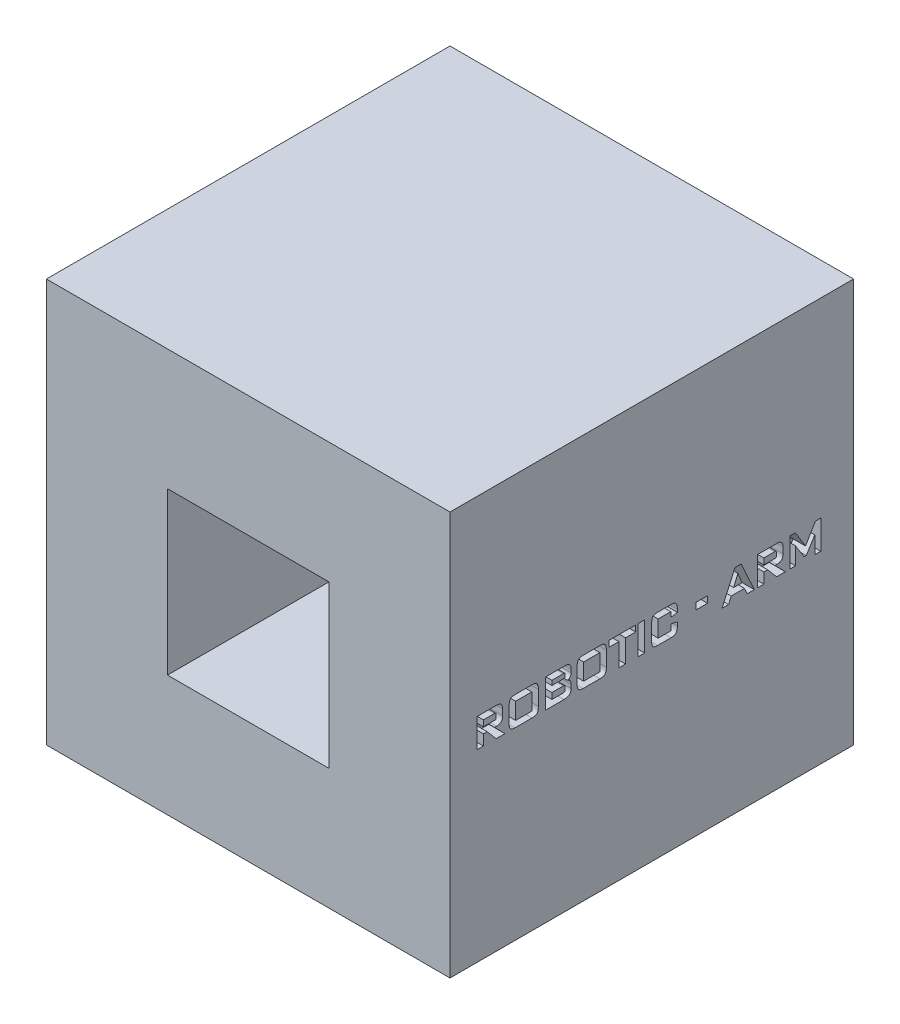
from build123d import *

# Parameters (mm, degrees)
ESQUISSE1_W                   = 50
ESQUISSE1_H                   = 50
ESQUISSE1_W_2                 = 20
ESQUISSE1_H_2                 = 20
BOSS_EXTRU_1_DEPTH            = 50
ESQUISSE5_W                   = 20
ESQUISSE5_H                   = 20
BOSS_EXTRU_5_DEPTH            = 1
ESQUISSE9_W                   = 20
ESQUISSE9_H                   = 20
BOSS_EXTRU_8_DEPTH            = 25
ESQUISSE10_W                  = 17
ESQUISSE10_H                  = 17
BOSS_EXTRU_9_DEPTH            = 10
ENL_V_START                   = -2
ENL_V_MAT_EXTRU_1_OUTLINE_W   = 2
ENL_V_MAT_EXTRU_1_OUTLINE_H   = 2.0625
ENL_V_MAT_EXTRU_1_OUTLINE_W_2 = 0.8125
ENL_V_MAT_EXTRU_1_OUTLINE_H_2 = 3.5625
ENL_V_MAT_EXTRU_1_OUTLINE_W_3 = 1.4375
ENL_V_MAT_EXTRU_1_OUTLINE_H_3 = 0.8125
ENL_V_MAT_EXTRU_1_DEPTH       = 2


# Read off the part's stored shape, not the designer's step: Enlèv. mat.-Extru.1
with BuildPart() as part:
    # Esquisse1 → Boss.-Extru.1 (new body)
    with BuildSketch(Plane.XY):
        with Locations((-14.262454104, 41.563864613)):
            Rectangle(ESQUISSE1_W, ESQUISSE1_H)
        with Locations((-14.262454104, 41.563864613)):
            Rectangle(ESQUISSE1_W_2, ESQUISSE1_H_2, mode=Mode.SUBTRACT)
    extrude(amount=BOSS_EXTRU_1_DEPTH)



with BuildPart() as body_2:
    # Esquisse5 → Boss.-Extru.5 (new body)
    with BuildSketch(Plane(origin=(0, 0, 0), x_dir=(-1, 0, 0), z_dir=(0, 0, -1))):
        with Locations((14.262454104, 41.563864613)):
            Rectangle(ESQUISSE5_W, ESQUISSE5_H)
    extrude(amount=BOSS_EXTRU_5_DEPTH)


with BuildPart() as part_1:
    add(part.part)

    add(body_2.part)  # Boss.-Extru.8 merges body 2
    # Esquisse9 → Boss.-Extru.8 (add)
    with BuildSketch(Plane.XY):
        with Locations((-14.262454104, 41.563864613)):
            Rectangle(ESQUISSE9_W, ESQUISSE9_H)
    extrude(amount=BOSS_EXTRU_8_DEPTH)

    # Esquisse10 → Boss.-Extru.9 (add)
    with BuildSketch(Plane(origin=(0, 0, -1), x_dir=(-1, 0, 0), z_dir=(0, 0, -1))):
        with Locations((14.262454104, 41.563864613)):
            Rectangle(ESQUISSE10_W, ESQUISSE10_H)
    extrude(amount=BOSS_EXTRU_9_DEPTH)

    # Enlèv. mat.-Extru.1 outline → Enlèv. mat.-Extru.1 (cut)
    # profile 1 of 11: a face of its own
    with BuildSketch(Plane(origin=(10.737545896, 0, 0), x_dir=(0, 0, -1), z_dir=(1, 0, 0)).offset(ENL_V_START)):
        with BuildLine():
            add(Edge.make_bspline(
                [(-9.494767923, 42.943838022), (-9.462202461, 42.943273829), (-9.399223316, 42.942182724), (-9.308307277, 42.933908591), (-9.224928323, 42.917691853), (-9.148019672, 42.897953209), (-9.078562995, 42.870581279), (-9.016316173, 42.837089542), (-8.961043247, 42.79819275), (-8.913653605, 42.75223849), (-8.872181622, 42.701149585), (-8.837393755, 42.643926122), (-8.806494551, 42.58213197), (-8.782522949, 42.514076077), (-8.762886777, 42.441003066), (-8.749318204, 42.362233228), (-8.741734313, 42.278298804), (-8.740512252, 42.22054609), (-8.73988511, 42.190908334)],
                knots=[0, 0, 0, 0, 0.07946826, 0.153685616, 0.222389009, 0.286552594, 0.347176836, 0.404041869, 0.458706221, 0.51151541, 0.56461057, 0.618834541, 0.67460726, 0.732902291, 0.794558509, 0.859070238, 0.927677135, 1, 1, 1, 1], degree=3))
            Line((-9.494767923, 42.943838022), (-11.92738511, 42.943838022))
            Line((-11.92738511, 42.943838022), (-11.92738511, 39.381338022))
            Line((-11.92738511, 39.381338022), (-11.11488511, 39.381338022))
            Line((-11.11488511, 39.381338022), (-11.11488511, 40.693838022))
            Line((-11.11488511, 40.693838022), (-10.654924173, 40.693838022))
            Line((-10.654924173, 40.693838022), (-9.53285386, 39.381338022))
            Line((-9.53285386, 39.381338022), (-8.448869485, 39.381338022))
            Line((-8.448869485, 39.381338022), (-9.734025735, 40.693838022))
            Line((-9.734025735, 40.693838022), (-9.494767923, 40.693838022))
            add(Edge.make_bspline(
                [(-8.73988511, 41.452627084), (-8.740505937, 41.422988371), (-8.741715691, 41.365233789), (-8.749415737, 41.280992876), (-8.762769552, 41.201864753), (-8.782486377, 41.12846068), (-8.806756701, 41.060233446), (-8.837077358, 40.997819151), (-8.872479261, 40.940321691), (-8.913635754, 40.888443763), (-8.96068988, 40.841348934), (-9.016632871, 40.802780817), (-9.078222727, 40.767727206), (-9.148252326, 40.741165315), (-9.224607655, 40.719236062), (-9.308532671, 40.70553928), (-9.399125128, 40.694999486), (-9.462180276, 40.694233759), (-9.494767923, 40.693838022)],
                knots=[0, 0, 0, 0, 0.072092161, 0.140480206, 0.205566229, 0.267025769, 0.325134843, 0.381441177, 0.435492177, 0.489036247, 0.542227895, 0.596717872, 0.653781811, 0.714212667, 0.778381974, 0.846724167, 0.920785238, 1, 1, 1, 1], degree=3))
            Line((-8.73988511, 41.452627084), (-8.73988511, 42.190908334))
        make_face()
        with BuildLine():
            add(Edge.make_bspline(
                [(-9.55238511, 42.009267709), (-9.552955056, 42.025892347), (-9.554001984, 42.056429962), (-9.561137036, 42.098309735), (-9.574707003, 42.131451737), (-9.594431296, 42.15783324), (-9.625480701, 42.175362931), (-9.667082813, 42.185427964), (-9.720689729, 42.193769253), (-9.760671699, 42.193813483), (-9.78285386, 42.193838022)],
                knots=[0, 0, 0, 0, 0.142165576, 0.261142378, 0.360895331, 0.446076577, 0.537230226, 0.658782582, 0.81069117, 1, 1, 1, 1], degree=3))
            Line((-9.55238511, 42.009267709), (-9.55238511, 41.631338022))
            add(Edge.make_bspline(
                [(-9.78285386, 41.443838022), (-9.760664504, 41.443852004), (-9.720346853, 41.443877409), (-9.666900862, 41.452388017), (-9.625061981, 41.461343604), (-9.594463442, 41.478916867), (-9.574443214, 41.505446871), (-9.561213484, 41.53943924), (-9.553932484, 41.582537981), (-9.552933062, 41.614057087), (-9.55238511, 41.631338022)],
                knots=[0, 0, 0, 0, 0.187399781, 0.340501955, 0.457438376, 0.547672803, 0.631995055, 0.733283697, 0.853767839, 1, 1, 1, 1], degree=3))
            Line((-9.78285386, 41.443838022), (-11.11488511, 41.443838022))
            Line((-11.11488511, 41.443838022), (-11.11488511, 42.193838022))
            Line((-11.11488511, 42.193838022), (-9.78285386, 42.193838022))
        make_face(mode=Mode.SUBTRACT)
    # profile 2 of 11: a face of its own
    with BuildSketch(Plane(origin=(10.737545896, 0, 0), x_dir=(0, 0, -1), z_dir=(1, 0, 0)).offset(ENL_V_START)):
        with BuildLine():
            add(Edge.make_bspline(
                [(-21.83363511, 40.237783334), (-21.834334457, 40.200339683), (-21.835679604, 40.128319341), (-21.842077109, 40.02426252), (-21.854324101, 39.928539069), (-21.87329825, 39.841625385), (-21.895105114, 39.762485564), (-21.923433552, 39.692150617), (-21.956487731, 39.629962548), (-21.995343269, 39.575903413), (-22.040973687, 39.528409152), (-22.097309224, 39.489567491), (-22.16186707, 39.454903873), (-22.236804413, 39.428418233), (-22.320345452, 39.406466342), (-22.413715183, 39.392996689), (-22.51633871, 39.382429177), (-22.588159447, 39.381712107), (-22.625627298, 39.381338022)],
                knots=[0, 0, 0, 0, 0.081880087, 0.157490831, 0.227854209, 0.292628153, 0.351875377, 0.407122702, 0.458076864, 0.505487682, 0.552296296, 0.601278529, 0.654451232, 0.712099286, 0.77459234, 0.843047091, 0.918119913, 1, 1, 1, 1], degree=3))
            Line((-21.83363511, 40.237783334), (-21.83363511, 40.684072397))
            Line((-21.83363511, 40.684072397), (-22.64613511, 40.881338022))
            Line((-22.64613511, 40.881338022), (-22.64613511, 40.131338022))
            Line((-22.64613511, 40.131338022), (-24.20863511, 40.131338022))
            Line((-24.20863511, 40.131338022), (-24.20863511, 42.193838022))
            Line((-24.20863511, 42.193838022), (-22.64613511, 42.193838022))
            Line((-22.64613511, 42.193838022), (-22.64613511, 41.568838022))
            Line((-22.64613511, 41.568838022), (-21.83363511, 41.711416147))
            Line((-21.83363511, 41.711416147), (-21.83363511, 42.065908334))
            add(Edge.make_bspline(
                [(-22.625627298, 42.943838022), (-22.588163654, 42.943434485), (-22.516350984, 42.942660959), (-22.413620217, 42.932473437), (-22.320299301, 42.917700792), (-22.236736516, 42.894860056), (-22.161837959, 42.867284833), (-22.096935504, 42.831814714), (-22.040878674, 42.790792566), (-21.995288087, 42.741394528), (-21.956489238, 42.685366483), (-21.923448332, 42.621253556), (-21.895100213, 42.548984016), (-21.873458077, 42.468202141), (-21.854207592, 42.379721752), (-21.842108217, 42.282347186), (-21.835697345, 42.176673613), (-21.834338302, 42.103677686), (-21.83363511, 42.065908334)],
                knots=[0, 0, 0, 0, 0.080900974, 0.155076084, 0.222825502, 0.284751225, 0.341956852, 0.394826846, 0.44405417, 0.49131847, 0.539309637, 0.590896566, 0.646790365, 0.706682118, 0.771369419, 0.842285922, 0.918396016, 1, 1, 1, 1], degree=3))
            Line((-22.625627298, 42.943838022), (-24.291642923, 42.943838022))
            add(Edge.make_bspline(
                [(-25.02113511, 42.065908334), (-25.020986273, 42.105315258), (-25.020699338, 42.181285949), (-25.012221593, 42.290396691), (-25.001225469, 42.390270711), (-24.984615532, 42.480677431), (-24.963597669, 42.561840705), (-24.937187316, 42.633868945), (-24.906260898, 42.696750649), (-24.869663738, 42.751240168), (-24.825094114, 42.796914769), (-24.77419335, 42.837757344), (-24.713411013, 42.870646132), (-24.64498543, 42.898133074), (-24.568000912, 42.917779855), (-24.483638698, 42.933973513), (-24.390438541, 42.942226977), (-24.325509861, 42.943285759), (-24.291642923, 42.943838022)],
                knots=[0, 0, 0, 0, 0.088133772, 0.169908814, 0.244705564, 0.312841486, 0.375376001, 0.432060239, 0.484171628, 0.531844694, 0.578203516, 0.626429652, 0.677289382, 0.732196002, 0.791024523, 0.854731229, 0.924227499, 1, 1, 1, 1], degree=3))
            Line((-25.02113511, 42.065908334), (-25.02113511, 40.237783334))
            add(Edge.make_bspline(
                [(-24.291642923, 39.381338022), (-24.325518873, 39.381847202), (-24.390464831, 39.382823386), (-24.483489351, 39.391635972), (-24.568190347, 39.405925496), (-24.644490143, 39.426724393), (-24.713682934, 39.45115705), (-24.773392545, 39.483870152), (-24.825662084, 39.521213651), (-24.86956887, 39.566190565), (-24.906026678, 39.619370708), (-24.937238491, 39.68049605), (-24.9635952, 39.750610826), (-24.984765867, 39.830129426), (-25.001120861, 39.918965823), (-25.01225398, 40.017192112), (-25.020694884, 40.124357524), (-25.020984692, 40.199027543), (-25.02113511, 40.237783334)],
                knots=[0, 0, 0, 0, 0.076738524, 0.147120802, 0.211508881, 0.271087406, 0.326163214, 0.377316322, 0.424819085, 0.47123874, 0.518912972, 0.570373564, 0.626399278, 0.688306311, 0.756585743, 0.830871253, 0.912217533, 1, 1, 1, 1], degree=3))
            Line((-24.291642923, 39.381338022), (-22.625627298, 39.381338022))
        make_face()
    # profile 3 of 11: a face of its own
    with BuildSketch(Plane(origin=(10.737545896, 0, 0), x_dir=(0, 0, -1), z_dir=(1, 0, 0)).offset(ENL_V_START)):
        with BuildLine():
            add(Edge.make_bspline(
                [(-34.25238511, 42.057119272), (-34.252235739, 42.096851473), (-34.251947688, 42.173471967), (-34.243469291, 42.28355929), (-34.232464812, 42.384403387), (-34.215874492, 42.475792795), (-34.194786629, 42.55789252), (-34.168694948, 42.630718597), (-34.13723721, 42.693979842), (-34.10092941, 42.749208727), (-34.056665227, 42.795933251), (-34.005399616, 42.836722254), (-33.94469334, 42.869757879), (-33.876064349, 42.89686525), (-33.799136736, 42.918261477), (-33.714186436, 42.933755319), (-33.620724832, 42.942281121), (-33.555787704, 42.943304319), (-33.52191636, 42.943838022)],
                knots=[0, 0, 0, 0, 0.088303584, 0.170286668, 0.245332224, 0.313751792, 0.376593188, 0.433600563, 0.485384508, 0.533356768, 0.579949956, 0.627873061, 0.678413211, 0.732974823, 0.791625999, 0.855644032, 0.924703619, 1, 1, 1, 1], degree=3))
            Line((-34.25238511, 42.057119272), (-34.25238511, 40.235830209))
            add(Edge.make_bspline(
                [(-33.52191636, 39.381338022), (-33.555793565, 39.381839922), (-33.620741927, 39.382802149), (-33.714069587, 39.391740682), (-33.79913855, 39.40579526), (-33.875737299, 39.426735936), (-33.944936853, 39.45115198), (-34.004630774, 39.483879089), (-34.05695193, 39.521185104), (-34.100485836, 39.566103263), (-34.137570218, 39.618503843), (-34.16866128, 39.679797656), (-34.194655444, 39.75035429), (-34.21591914, 39.829817089), (-34.232479311, 39.918295993), (-34.24342801, 40.015897514), (-34.251985391, 40.122725967), (-34.25224814, 40.197073321), (-34.25238511, 40.235830209)],
                knots=[0, 0, 0, 0, 0.076788179, 0.147215998, 0.212372928, 0.271990005, 0.32710145, 0.378287657, 0.425821157, 0.472270849, 0.519372662, 0.570866552, 0.627618968, 0.689566058, 0.757164318, 0.831497895, 0.912160733, 1, 1, 1, 1], degree=3))
            Line((-33.52191636, 39.381338022), (-31.423283548, 39.381338022))
            add(Edge.make_bspline(
                [(-30.62738511, 40.235830209), (-30.628102588, 40.198715255), (-30.629488418, 40.127026706), (-30.635697418, 40.023254434), (-30.648455684, 39.928050205), (-30.66548382, 39.840966647), (-30.689485796, 39.7629196), (-30.715893807, 39.691910642), (-30.749342308, 39.629984218), (-30.788120954, 39.575933421), (-30.833836642, 39.528073691), (-30.890958173, 39.489882629), (-30.955580502, 39.454860472), (-31.030848251, 39.428268968), (-31.115089109, 39.406497441), (-31.20942024, 39.392994226), (-31.313021206, 39.382433375), (-31.38549068, 39.381713459), (-31.423283548, 39.381338022)],
                knots=[0, 0, 0, 0, 0.081024491, 0.156501018, 0.226739494, 0.290557624, 0.349899923, 0.404787687, 0.455651401, 0.50297806, 0.549703584, 0.599178746, 0.652257063, 0.709802786, 0.77287299, 0.841908117, 0.917555002, 1, 1, 1, 1], degree=3))
            Line((-30.62738511, 40.235830209), (-30.62738511, 42.057119272))
            add(Edge.make_bspline(
                [(-31.423283548, 42.943838022), (-31.385496456, 42.943429393), (-31.313038059, 42.942645829), (-31.209309769, 42.932514511), (-31.115097629, 42.917542775), (-31.030488287, 42.895396411), (-30.95563835, 42.865781466), (-30.889830927, 42.831215946), (-30.833723971, 42.789735851), (-30.787697954, 42.740346039), (-30.749665227, 42.68348631), (-30.715854363, 42.619575324), (-30.68935637, 42.546314105), (-30.665379812, 42.465314666), (-30.648592387, 42.374949276), (-30.635683539, 42.276524959), (-30.629476378, 42.169500646), (-30.628099992, 42.095535885), (-30.62738511, 42.057119272)],
                knots=[0, 0, 0, 0, 0.080885147, 0.155100802, 0.222940896, 0.284994247, 0.341948186, 0.394965447, 0.443759134, 0.49060709, 0.538749164, 0.589881672, 0.645032593, 0.705258106, 0.770602845, 0.841585947, 0.917721205, 1, 1, 1, 1], degree=3))
            Line((-31.423283548, 42.943838022), (-33.52191636, 42.943838022))
        make_face()
        with Locations((-32.43988511, 41.162588022)):
            Rectangle(ENL_V_MAT_EXTRU_1_OUTLINE_W, ENL_V_MAT_EXTRU_1_OUTLINE_H, mode=Mode.SUBTRACT)
    # profile 4 of 11: a face of its own
    with BuildSketch(Plane(origin=(10.737545896, 0, 0), x_dir=(0, 0, -1), z_dir=(1, 0, 0)).offset(ENL_V_START)):
        with BuildLine():
            add(Edge.make_bspline(
                [(-35.71097886, 42.943838022), (-35.679699798, 42.943417552), (-35.619577809, 42.94260936), (-35.533033454, 42.932519692), (-35.453380653, 42.916849), (-35.380181336, 42.896426361), (-35.314747629, 42.867098912), (-35.2554686, 42.833280437), (-35.203467311, 42.792122197), (-35.158875334, 42.744343906), (-35.120914982, 42.69059421), (-35.086208216, 42.632695267), (-35.059506717, 42.567785221), (-35.035299269, 42.498629375), (-35.018905689, 42.423068852), (-35.004079745, 42.342797071), (-34.998365771, 42.25641461), (-34.996894187, 42.197093477), (-34.99613511, 42.166494272)],
                knots=[0, 0, 0, 0, 0.077041359, 0.148082437, 0.21430979, 0.277003765, 0.33482896, 0.390546176, 0.444788883, 0.497564648, 0.550994684, 0.6067119, 0.663481556, 0.723597955, 0.787026531, 0.853752332, 0.924562087, 1, 1, 1, 1], degree=3))
            Line((-35.71097886, 42.943838022), (-38.18363511, 42.943838022))
            Line((-38.18363511, 42.943838022), (-38.18363511, 39.381338022))
            Line((-38.18363511, 39.381338022), (-35.887736673, 39.381338022))
            add(Edge.make_bspline(
                [(-34.99613511, 40.124502084), (-34.997058976, 40.095840213), (-34.998870026, 40.039654512), (-35.007902019, 39.957693782), (-35.026214113, 39.881118768), (-35.049082114, 39.809010361), (-35.080404665, 39.742422224), (-35.119424848, 39.681556513), (-35.162890437, 39.624065864), (-35.215253878, 39.573267193), (-35.274568694, 39.528264885), (-35.34014202, 39.487601133), (-35.413821228, 39.454650005), (-35.494909888, 39.428610438), (-35.582658963, 39.407146772), (-35.677943943, 39.391439065), (-35.780483538, 39.38297316), (-35.851263461, 39.381894078), (-35.887736673, 39.381338022)],
                knots=[0, 0, 0, 0, 0.06492289, 0.127267965, 0.186264736, 0.242898697, 0.298286524, 0.352268882, 0.406371848, 0.461093725, 0.51681398, 0.574704782, 0.635394324, 0.69902002, 0.767302902, 0.839757828, 0.917426489, 1, 1, 1, 1], degree=3))
            Line((-34.99613511, 40.124502084), (-34.99613511, 40.562978647))
            add(Edge.make_bspline(
                [(-35.459025735, 41.247548959), (-35.427724982, 41.247000934), (-35.36551159, 41.245911679), (-35.276721876, 41.206773125), (-35.197048029, 41.142646435), (-35.127700122, 41.054357297), (-35.068683371, 40.949445517), (-35.026785505, 40.830113325), (-35.000962812, 40.700154619), (-34.997777769, 40.60965373), (-34.99613511, 40.562978647)],
                knots=[0, 0, 0, 0, 0.101702744, 0.202144428, 0.310772747, 0.434394943, 0.567644187, 0.703628226, 0.847148715, 1, 1, 1, 1], degree=3))
            add(Edge.make_bspline(
                [(-34.99613511, 41.813955209), (-34.997779497, 41.774426129), (-35.00095574, 41.698073067), (-35.026803944, 41.588021111), (-35.071130423, 41.488412991), (-35.131608349, 41.401275133), (-35.201952134, 41.328522276), (-35.282637154, 41.27852399), (-35.368848935, 41.2470958), (-35.428816212, 41.247397149), (-35.459025735, 41.247548959)],
                knots=[0, 0, 0, 0, 0.145117502, 0.280304162, 0.412548956, 0.543259699, 0.668424757, 0.781256525, 0.889804298, 1, 1, 1, 1], degree=3))
            Line((-34.99613511, 41.813955209), (-34.99613511, 42.166494272))
        make_face()
        with BuildLine():
            add(Edge.make_bspline(
                [(-35.74613511, 40.638173959), (-35.746745119, 40.660634713), (-35.747854761, 40.701492174), (-35.754324416, 40.757162619), (-35.769052579, 40.800130768), (-35.789130783, 40.834411394), (-35.822187126, 40.856950543), (-35.865692835, 40.872193673), (-35.922305615, 40.879981552), (-35.964216762, 40.880855642), (-35.987346048, 40.881338022)],
                knots=[0, 0, 0, 0, 0.164472802, 0.299185921, 0.407638349, 0.495492839, 0.584086561, 0.6933465, 0.830768739, 1, 1, 1, 1], degree=3))
            Line((-35.74613511, 40.638173959), (-35.74613511, 40.377431772))
            add(Edge.make_bspline(
                [(-35.987346048, 40.131338022), (-35.964497462, 40.13163765), (-35.922776769, 40.13218476), (-35.867047321, 40.142107898), (-35.822900073, 40.155449179), (-35.789967133, 40.178718595), (-35.768633868, 40.213082127), (-35.756052229, 40.257868163), (-35.747326014, 40.313619194), (-35.746555103, 40.354927147), (-35.74613511, 40.377431772)],
                knots=[0, 0, 0, 0, 0.166069032, 0.303236054, 0.411179558, 0.499357546, 0.590079198, 0.69952163, 0.836299002, 1, 1, 1, 1], degree=3))
            Line((-35.987346048, 40.131338022), (-37.37113511, 40.131338022))
            Line((-37.37113511, 40.131338022), (-37.37113511, 40.881338022))
            Line((-37.37113511, 40.881338022), (-35.987346048, 40.881338022))
        make_face(mode=Mode.SUBTRACT)
        with BuildLine():
            add(Edge.make_bspline(
                [(-35.74613511, 42.049306772), (-35.746525533, 42.061772456), (-35.74724658, 42.084794572), (-35.756783535, 42.116080873), (-35.769704256, 42.142949914), (-35.792797489, 42.162734838), (-35.824196314, 42.177790095), (-35.867337502, 42.18786563), (-35.923091469, 42.192886443), (-35.96454821, 42.193500397), (-35.987346048, 42.193838022)],
                knots=[0, 0, 0, 0, 0.11429184, 0.211078672, 0.299618904, 0.384531008, 0.485098745, 0.618179583, 0.790029807, 1, 1, 1, 1], degree=3))
            Line((-35.74613511, 42.049306772), (-35.74613511, 41.775869272))
            add(Edge.make_bspline(
                [(-35.987346048, 41.631338022), (-35.964215496, 41.631608187), (-35.922420157, 41.632096356), (-35.86617654, 41.63779846), (-35.823037473, 41.646218159), (-35.791333363, 41.660309468), (-35.769986268, 41.680959257), (-35.755047797, 41.706878865), (-35.747776478, 41.739694186), (-35.746712391, 41.763146233), (-35.74613511, 41.775869272)],
                knots=[0, 0, 0, 0, 0.211790088, 0.382690352, 0.517234227, 0.613254829, 0.695510789, 0.785013758, 0.883367184, 1, 1, 1, 1], degree=3))
            Line((-35.987346048, 41.631338022), (-37.37113511, 41.631338022))
            Line((-37.37113511, 41.631338022), (-37.37113511, 42.193838022))
            Line((-37.37113511, 42.193838022), (-35.987346048, 42.193838022))
        make_face(mode=Mode.SUBTRACT)
    # profile 5 of 11: a face of its own
    with BuildSketch(Plane(origin=(10.737545896, 0, 0), x_dir=(0, 0, -1), z_dir=(1, 0, 0)).offset(ENL_V_START)):
        with BuildLine():
            add(Edge.make_bspline(
                [(-42.67738511, 42.057119272), (-42.677235739, 42.096851473), (-42.676947688, 42.173471967), (-42.668469291, 42.28355929), (-42.657464812, 42.384403387), (-42.640874492, 42.475792795), (-42.619786629, 42.55789252), (-42.593694948, 42.630718597), (-42.56223721, 42.693979842), (-42.52592941, 42.749208727), (-42.481665227, 42.795933251), (-42.430399616, 42.836722254), (-42.36969334, 42.869757879), (-42.301064349, 42.89686525), (-42.224136736, 42.918261477), (-42.139186436, 42.933755319), (-42.045724832, 42.942281121), (-41.980787704, 42.943304319), (-41.94691636, 42.943838022)],
                knots=[0, 0, 0, 0, 0.088303584, 0.170286668, 0.245332224, 0.313751792, 0.376593188, 0.433600563, 0.485384508, 0.533356768, 0.579949956, 0.627873061, 0.678413211, 0.732974823, 0.791625999, 0.855644032, 0.924703619, 1, 1, 1, 1], degree=3))
            Line((-42.67738511, 42.057119272), (-42.67738511, 40.235830209))
            add(Edge.make_bspline(
                [(-41.94691636, 39.381338022), (-41.980793565, 39.381839922), (-42.045741927, 39.382802149), (-42.139069587, 39.391740682), (-42.22413855, 39.40579526), (-42.300737299, 39.426735936), (-42.369936853, 39.45115198), (-42.429630774, 39.483879089), (-42.48195193, 39.521185104), (-42.525485836, 39.566103263), (-42.562570218, 39.618503843), (-42.59366128, 39.679797656), (-42.619655444, 39.75035429), (-42.64091914, 39.829817089), (-42.657479311, 39.918295993), (-42.66842801, 40.015897514), (-42.676985391, 40.122725967), (-42.67724814, 40.197073321), (-42.67738511, 40.235830209)],
                knots=[0, 0, 0, 0, 0.076788179, 0.147215998, 0.212372928, 0.271990005, 0.32710145, 0.378287657, 0.425821157, 0.472270849, 0.519372662, 0.570866552, 0.627618968, 0.689566058, 0.757164318, 0.831497895, 0.912160733, 1, 1, 1, 1], degree=3))
            Line((-41.94691636, 39.381338022), (-39.848283548, 39.381338022))
            add(Edge.make_bspline(
                [(-39.05238511, 40.235830209), (-39.053102588, 40.198715255), (-39.054488418, 40.127026706), (-39.060697418, 40.023254434), (-39.073455684, 39.928050205), (-39.09048382, 39.840966647), (-39.114485796, 39.7629196), (-39.140893807, 39.691910642), (-39.174342308, 39.629984218), (-39.213120954, 39.575933421), (-39.258836642, 39.528073691), (-39.315958173, 39.489882629), (-39.380580502, 39.454860472), (-39.455848251, 39.428268968), (-39.540089109, 39.406497441), (-39.63442024, 39.392994226), (-39.738021206, 39.382433375), (-39.81049068, 39.381713459), (-39.848283548, 39.381338022)],
                knots=[0, 0, 0, 0, 0.081024491, 0.156501018, 0.226739494, 0.290557624, 0.349899923, 0.404787687, 0.455651401, 0.50297806, 0.549703584, 0.599178746, 0.652257063, 0.709802786, 0.77287299, 0.841908117, 0.917555002, 1, 1, 1, 1], degree=3))
            Line((-39.05238511, 40.235830209), (-39.05238511, 42.057119272))
            add(Edge.make_bspline(
                [(-39.848283548, 42.943838022), (-39.810496456, 42.943429393), (-39.738038059, 42.942645829), (-39.634309769, 42.932514511), (-39.540097629, 42.917542775), (-39.455488287, 42.895396411), (-39.38063835, 42.865781466), (-39.314830927, 42.831215946), (-39.258723971, 42.789735851), (-39.212697954, 42.740346039), (-39.174665227, 42.68348631), (-39.140854363, 42.619575324), (-39.11435637, 42.546314105), (-39.090379812, 42.465314666), (-39.073592387, 42.374949276), (-39.060683539, 42.276524959), (-39.054476378, 42.169500646), (-39.053099992, 42.095535885), (-39.05238511, 42.057119272)],
                knots=[0, 0, 0, 0, 0.080885147, 0.155100802, 0.222940896, 0.284994247, 0.341948186, 0.394965447, 0.443759134, 0.49060709, 0.538749164, 0.589881672, 0.645032593, 0.705258106, 0.770602845, 0.841585947, 0.917721205, 1, 1, 1, 1], degree=3))
            Line((-39.848283548, 42.943838022), (-41.94691636, 42.943838022))
        make_face()
        with Locations((-40.86488511, 41.162588022)):
            Rectangle(ENL_V_MAT_EXTRU_1_OUTLINE_W, ENL_V_MAT_EXTRU_1_OUTLINE_H, mode=Mode.SUBTRACT)
    # profile 6 of 11: a face of its own
    with BuildSketch(Plane(origin=(10.737545896, 0, 0), x_dir=(0, 0, -1), z_dir=(1, 0, 0)).offset(ENL_V_START)):
        with BuildLine():
            add(Edge.make_bspline(
                [(-44.238517923, 42.943838022), (-44.205952461, 42.943273829), (-44.142973316, 42.942182724), (-44.052057277, 42.933908591), (-43.968678323, 42.917691853), (-43.891769672, 42.897953209), (-43.822312995, 42.870581279), (-43.760066173, 42.837089542), (-43.704793247, 42.79819275), (-43.657403605, 42.75223849), (-43.615931622, 42.701149585), (-43.581143755, 42.643926122), (-43.550244551, 42.58213197), (-43.526272949, 42.514076077), (-43.506636777, 42.441003066), (-43.493068204, 42.362233228), (-43.485484313, 42.278298804), (-43.484262252, 42.22054609), (-43.48363511, 42.190908334)],
                knots=[0, 0, 0, 0, 0.07946826, 0.153685616, 0.222389009, 0.286552594, 0.347176836, 0.404041869, 0.458706221, 0.51151541, 0.56461057, 0.618834541, 0.67460726, 0.732902291, 0.794558509, 0.859070238, 0.927677135, 1, 1, 1, 1], degree=3))
            Line((-44.238517923, 42.943838022), (-46.67113511, 42.943838022))
            Line((-46.67113511, 42.943838022), (-46.67113511, 39.381338022))
            Line((-46.67113511, 39.381338022), (-45.85863511, 39.381338022))
            Line((-45.85863511, 39.381338022), (-45.85863511, 40.693838022))
            Line((-45.85863511, 40.693838022), (-45.398674173, 40.693838022))
            Line((-45.398674173, 40.693838022), (-44.27660386, 39.381338022))
            Line((-44.27660386, 39.381338022), (-43.192619485, 39.381338022))
            Line((-43.192619485, 39.381338022), (-44.477775735, 40.693838022))
            Line((-44.477775735, 40.693838022), (-44.238517923, 40.693838022))
            add(Edge.make_bspline(
                [(-43.48363511, 41.452627084), (-43.484255937, 41.422988371), (-43.485465691, 41.365233789), (-43.493165737, 41.280992876), (-43.506519552, 41.201864753), (-43.526236377, 41.12846068), (-43.550506701, 41.060233446), (-43.580827358, 40.997819151), (-43.616229261, 40.940321691), (-43.657385754, 40.888443763), (-43.70443988, 40.841348934), (-43.760382871, 40.802780817), (-43.821972727, 40.767727206), (-43.892002326, 40.741165315), (-43.968357655, 40.719236062), (-44.052282671, 40.70553928), (-44.142875128, 40.694999486), (-44.205930276, 40.694233759), (-44.238517923, 40.693838022)],
                knots=[0, 0, 0, 0, 0.072092161, 0.140480206, 0.205566229, 0.267025769, 0.325134843, 0.381441177, 0.435492177, 0.489036247, 0.542227895, 0.596717872, 0.653781811, 0.714212667, 0.778381974, 0.846724167, 0.920785238, 1, 1, 1, 1], degree=3))
            Line((-43.48363511, 41.452627084), (-43.48363511, 42.190908334))
        make_face()
        with BuildLine():
            add(Edge.make_bspline(
                [(-44.29613511, 42.009267709), (-44.296705056, 42.025892347), (-44.297751984, 42.056429962), (-44.304887036, 42.098309735), (-44.318457003, 42.131451737), (-44.338181296, 42.15783324), (-44.369230701, 42.175362931), (-44.410832813, 42.185427964), (-44.464439729, 42.193769253), (-44.504421699, 42.193813483), (-44.52660386, 42.193838022)],
                knots=[0, 0, 0, 0, 0.142165576, 0.261142378, 0.360895331, 0.446076577, 0.537230226, 0.658782582, 0.81069117, 1, 1, 1, 1], degree=3))
            Line((-44.29613511, 42.009267709), (-44.29613511, 41.631338022))
            add(Edge.make_bspline(
                [(-44.52660386, 41.443838022), (-44.504414504, 41.443852004), (-44.464096853, 41.443877409), (-44.410650862, 41.452388017), (-44.368811981, 41.461343604), (-44.338213442, 41.478916867), (-44.318193214, 41.505446871), (-44.304963484, 41.53943924), (-44.297682484, 41.582537981), (-44.296683062, 41.614057087), (-44.29613511, 41.631338022)],
                knots=[0, 0, 0, 0, 0.187399781, 0.340501955, 0.457438376, 0.547672803, 0.631995055, 0.733283697, 0.853767839, 1, 1, 1, 1], degree=3))
            Line((-44.52660386, 41.443838022), (-45.85863511, 41.443838022))
            Line((-45.85863511, 41.443838022), (-45.85863511, 42.193838022))
            Line((-45.85863511, 42.193838022), (-44.52660386, 42.193838022))
        make_face(mode=Mode.SUBTRACT)
    # profile 7 of 11: a face of its own
    with BuildSketch(Plane(origin=(10.737545896, 0, 0), x_dir=(0, 0, -1), z_dir=(1, 0, 0)).offset(ENL_V_START)):
        Polygon((-7.87113511, 39.381338022), (-7.18363511, 39.381338022), (-7.18363511, 41.517502743), (-6.12113511, 39.818838022), (-5.868205423, 39.818838022), (-4.80863511, 41.510581047), (-4.80863511, 39.381338022), (-4.05863511, 39.381338022), (-4.05863511, 42.943838022), (-4.733439798, 42.943838022), (-5.947306985, 40.882314584), (-7.223674173, 42.943838022), (-7.87113511, 42.943838022), align=None)
    # profile 8 of 11: a face of its own
    with BuildSketch(Plane(origin=(10.737545896, 0, 0), x_dir=(0, 0, -1), z_dir=(1, 0, 0)).offset(ENL_V_START)):
        Polygon((-16.29613511, 39.381338022), (-15.48754136, 39.381338022), (-15.162346048, 40.131338022), (-13.528556985, 40.131338022), (-13.192619485, 39.381338022), (-12.29613511, 39.381338022), (-13.927971048, 42.943838022), (-14.692619485, 42.943838022), align=None)
        Polygon((-14.857658548, 40.881338022), (-14.334221048, 42.152822397), (-13.81957261, 40.881338022), align=None, mode=Mode.SUBTRACT)
    # profile 9 of 11: a face of its own
    with BuildSketch(Plane(origin=(10.737545896, 0, 0), x_dir=(0, 0, -1), z_dir=(1, 0, 0)).offset(ENL_V_START)):
        with Locations((-26.29613511, 41.162588022)):
            Rectangle(ENL_V_MAT_EXTRU_1_OUTLINE_W_2, ENL_V_MAT_EXTRU_1_OUTLINE_H_2)
    # profile 10 of 11: a face of its own
    with BuildSketch(Plane(origin=(10.737545896, 0, 0), x_dir=(0, 0, -1), z_dir=(1, 0, 0)).offset(ENL_V_START)):
        Polygon((-29.07113511, 39.381338022), (-28.25863511, 39.381338022), (-28.25863511, 42.193838022), (-27.00863511, 42.193838022), (-27.00863511, 42.943838022), (-30.32113511, 42.943838022), (-30.32113511, 42.193838022), (-29.07113511, 42.193838022), align=None)
    # profile 11 of 11: a face of its own
    with BuildSketch(Plane(origin=(10.737545896, 0, 0), x_dir=(0, 0, -1), z_dir=(1, 0, 0)).offset(ENL_V_START)):
        with Locations((-18.81488511, 41.225088022)):
            Rectangle(ENL_V_MAT_EXTRU_1_OUTLINE_W_3, ENL_V_MAT_EXTRU_1_OUTLINE_H_3)
    extrude(amount=ENL_V_MAT_EXTRU_1_DEPTH, mode=Mode.SUBTRACT)


solid = part_1.part
